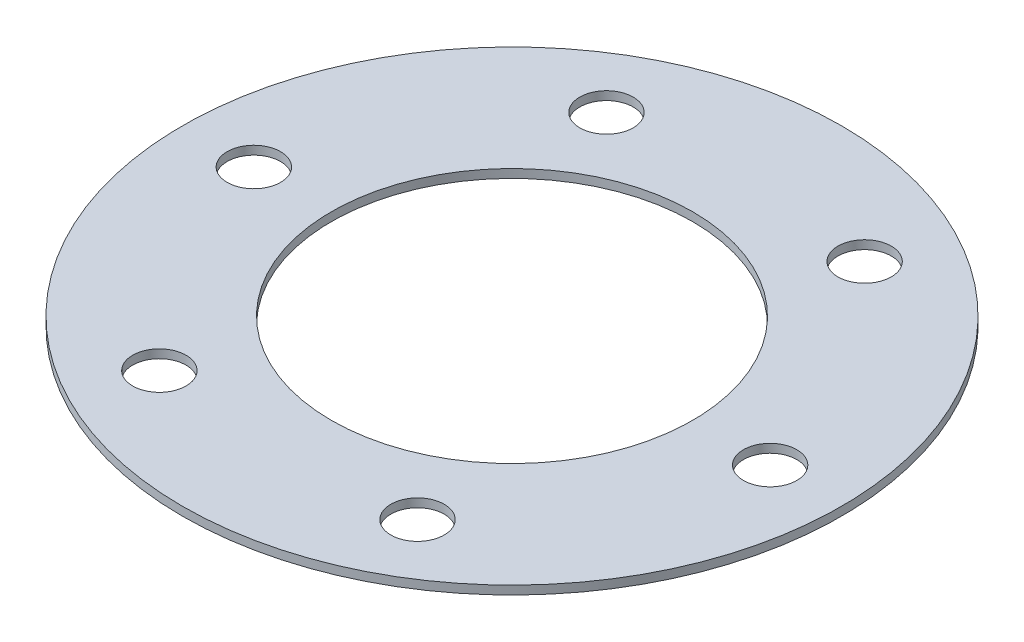
from build123d import *

# Parameters (mm, degrees)
SKETCH1_R           = 38.3
SKETCH1_R_2         = 3.1
SKETCH1_R_3         = 21
BOSS_EXTRUDE1_DEPTH = 1


with BuildPart() as part:
    # Sketch1 → Boss-Extrude1 (new body)
    with BuildSketch(Plane(origin=(0, 0, 0), x_dir=(1, 0, 0), z_dir=(0, 1, 0))):
        Circle(SKETCH1_R)
        with Locations((30, 0)):
            Circle(SKETCH1_R_2, mode=Mode.SUBTRACT)
        Circle(SKETCH1_R_3, mode=Mode.SUBTRACT)
        with Locations((15, -25.980762114)):
            Circle(SKETCH1_R_2, mode=Mode.SUBTRACT)
        with Locations((-15, -25.980762114)):
            Circle(SKETCH1_R_2, mode=Mode.SUBTRACT)
        with Locations((-30, 0)):
            Circle(SKETCH1_R_2, mode=Mode.SUBTRACT)
        with Locations((-15, 25.980762114)):
            Circle(SKETCH1_R_2, mode=Mode.SUBTRACT)
        with Locations((15, 25.980762114)):
            Circle(SKETCH1_R_2, mode=Mode.SUBTRACT)
    extrude(amount=BOSS_EXTRUDE1_DEPTH)


solid = part.part
